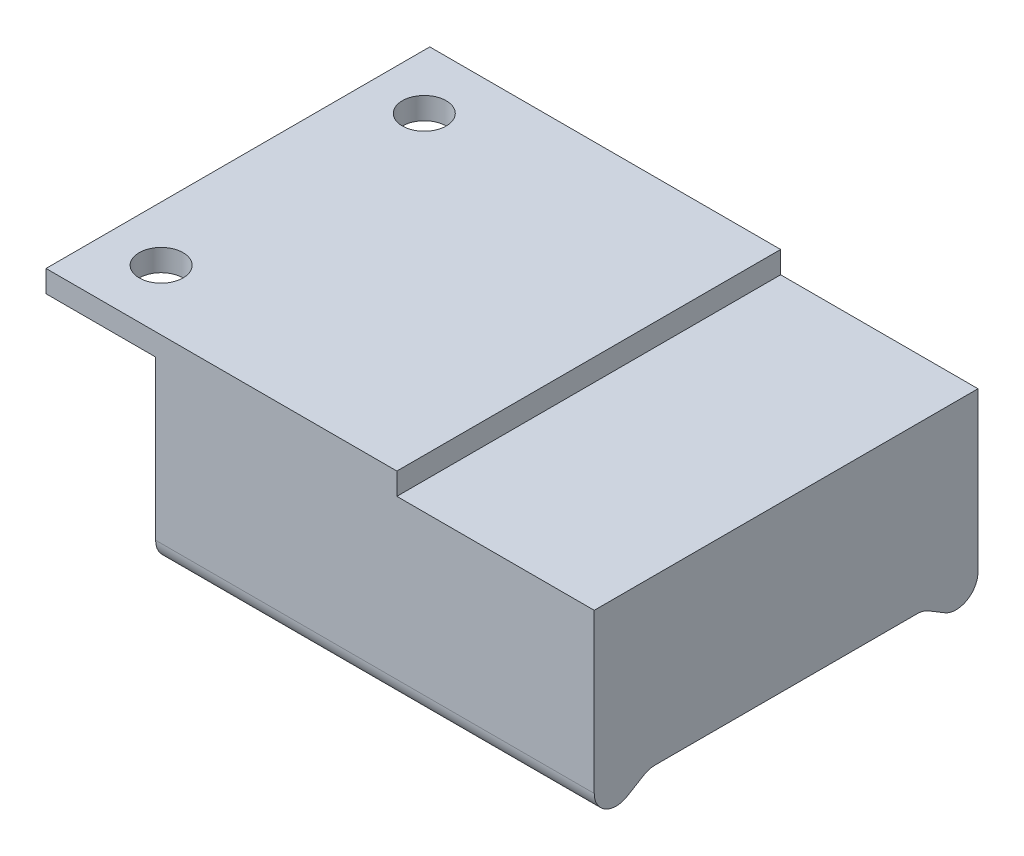
from build123d import *

# Parameters (mm, degrees)
SKETCH1_W               = 40
SKETCH1_H               = 35
BOSS_EXTRUDE1_DEPTH     = 20
CUT_EXTRUDE1_DEPTH      = 49.023431781
CUT_EXTRUDE1_DEPTH_BACK = 49.023431781
FILLET1_R               = 2
SKETCH8_W               = 20
SKETCH8_H               = 2
CUT_EXTRUDE5_DEPTH      = 45.340195765
SKETCH5_W               = 35
SKETCH5_H               = 2
BOSS_EXTRUDE3_DEPTH     = 10
SKETCH12_R              = 2
CUT_EXTRUDE7_DEPTH      = 40.335772021


with BuildPart() as part:
    # Sketch1 → Boss-Extrude1 (new body)
    with BuildSketch(Plane(origin=(0, 0, 0), x_dir=(1, 0, 0), z_dir=(0, 1, 0))):
        Rectangle(SKETCH1_W, SKETCH1_H)
    extrude(amount=-BOSS_EXTRUDE1_DEPTH)

    # Sketch2 → Cut-Extrude1 (cut, two sides: drawn at the far end of the back side and taken through both)
    with BuildSketch(Plane(origin=(20, 0, 0), x_dir=(0, 0, -1), z_dir=(1, 0, 0)).offset(-CUT_EXTRUDE1_DEPTH_BACK)):
        Polygon((-12.5, -17), (-17.5, -20), (17.5, -20), (12.5, -17), align=None)
    extrude(amount=CUT_EXTRUDE1_DEPTH + CUT_EXTRUDE1_DEPTH_BACK, mode=Mode.SUBTRACT)

    # Fillet1
    fillet1_edges = [part.edges().sort_by_distance(p)[0] for p in [
        (0, -17, 12.5),
        (0, -17, -12.5),
        (0, -20, -17.5),
        (0, -20, 17.5),
    ]]
    fillet(fillet1_edges, radius=FILLET1_R)

    # Sketch8 → Cut-Extrude5 (cut, through all)
    with BuildSketch(Plane.XY.offset(17.5)):
        with Locations((12, -1)):
            Rectangle(SKETCH8_W, SKETCH8_H)
    extrude(amount=-CUT_EXTRUDE5_DEPTH, mode=Mode.SUBTRACT)

    # Sketch5 → Boss-Extrude3 (add)
    with BuildSketch(Plane.ZY.offset(20)):
        with Locations((0, -1)):
            Rectangle(SKETCH5_W, SKETCH5_H)
    extrude(amount=BOSS_EXTRUDE3_DEPTH)

    # Sketch12 → Cut-Extrude7 (cut, through all)
    with BuildSketch(Plane(origin=(0, 0, 0), x_dir=(1, 0, 0), z_dir=(0, 1, 0))):
        with Locations((-25, 12)):
            Circle(SKETCH12_R)
        with Locations((-25, -12)):
            Circle(SKETCH12_R)
    extrude(amount=-CUT_EXTRUDE7_DEPTH, mode=Mode.SUBTRACT)


solid = part.part
